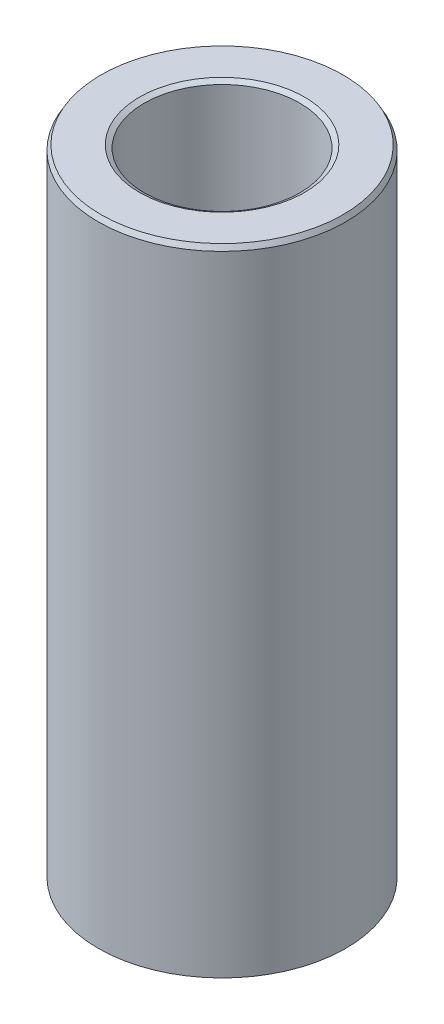
from build123d import *
from OCP.BRepFilletAPI import BRepFilletAPI_MakeChamfer

# Parameters (mm, degrees)
SKETCH1_R           = 60
BOSS_EXTRUDE1_DEPTH = 308.567477132
SKETCH2_R           = 37.696062812
CUT_EXTRUDE1_DEPTH  = 321.021699176
CHAMFER1_SIZE       = 2.335977862
CHAMFER1_SIZE2      = 1.348677447


with BuildPart() as part:
    # Sketch1 → Boss-Extrude1 (new body)
    with BuildSketch(Plane(origin=(0, 0, 0), x_dir=(1, 0, 0), z_dir=(0, 1, 0))):
        Circle(SKETCH1_R)
    extrude(amount=BOSS_EXTRUDE1_DEPTH)

    # Sketch2 → Cut-Extrude1 (cut, through all)
    with BuildSketch(Plane(origin=(0, 0, 0), x_dir=(1, 0, 0), z_dir=(0, 1, 0))):
        Circle(SKETCH2_R)
    extrude(amount=CUT_EXTRUDE1_DEPTH, mode=Mode.SUBTRACT)

    # Chamfer1: one chamfer whose edges measure the first distance from different faces: ONE call of the kernel's chamfer builder (chamfer() names one face for all edges)
    chamfer1_edges_1 = [part.edges().sort_by_distance(p)[0] for p in [
        (-37.696062812, 308.567477132, 0),
    ]]
    chamfer1_side_1 = [part.faces().sort_by_distance(p)[0] for p in [
        (-58.302943725, 308.567477132, 0),
    ]]
    chamfer1_edges_2 = [part.edges().sort_by_distance(p)[0] for p in [
        (-37.696062812, 0, 0),
    ]]
    chamfer1_side_2 = [part.faces().sort_by_distance(p)[0] for p in [
        (-37.696062812, 154.283738566, 0),
    ]]
    chamfer1_edges_3 = [part.edges().sort_by_distance(p)[0] for p in [
        (-60, 0, 0),
    ]]
    chamfer1_side_3 = [part.faces().sort_by_distance(p)[0] for p in [
        (-58.302943725, 0, 0),
    ]]
    chamfer1_edges_4 = [part.edges().sort_by_distance(p)[0] for p in [
        (-60, 308.567477132, 0),
    ]]
    chamfer1_side_4 = [part.faces().sort_by_distance(p)[0] for p in [
        (-60, 154.283738566, 0),
    ]]
    chamfer1 = BRepFilletAPI_MakeChamfer(part.part.solid().wrapped)
    for e in chamfer1_edges_1:
        chamfer1.Add(CHAMFER1_SIZE, CHAMFER1_SIZE2, e.wrapped, chamfer1_side_1[0].wrapped)  # the first distance lies on this face
    for e in chamfer1_edges_2:
        chamfer1.Add(CHAMFER1_SIZE, CHAMFER1_SIZE2, e.wrapped, chamfer1_side_2[0].wrapped)  # the first distance lies on this face
    for e in chamfer1_edges_3:
        chamfer1.Add(CHAMFER1_SIZE, CHAMFER1_SIZE2, e.wrapped, chamfer1_side_3[0].wrapped)  # the first distance lies on this face
    for e in chamfer1_edges_4:
        chamfer1.Add(CHAMFER1_SIZE, CHAMFER1_SIZE2, e.wrapped, chamfer1_side_4[0].wrapped)  # the first distance lies on this face
    add(Compound.cast(chamfer1.Shape()), mode=Mode.REPLACE)


solid = part.part
